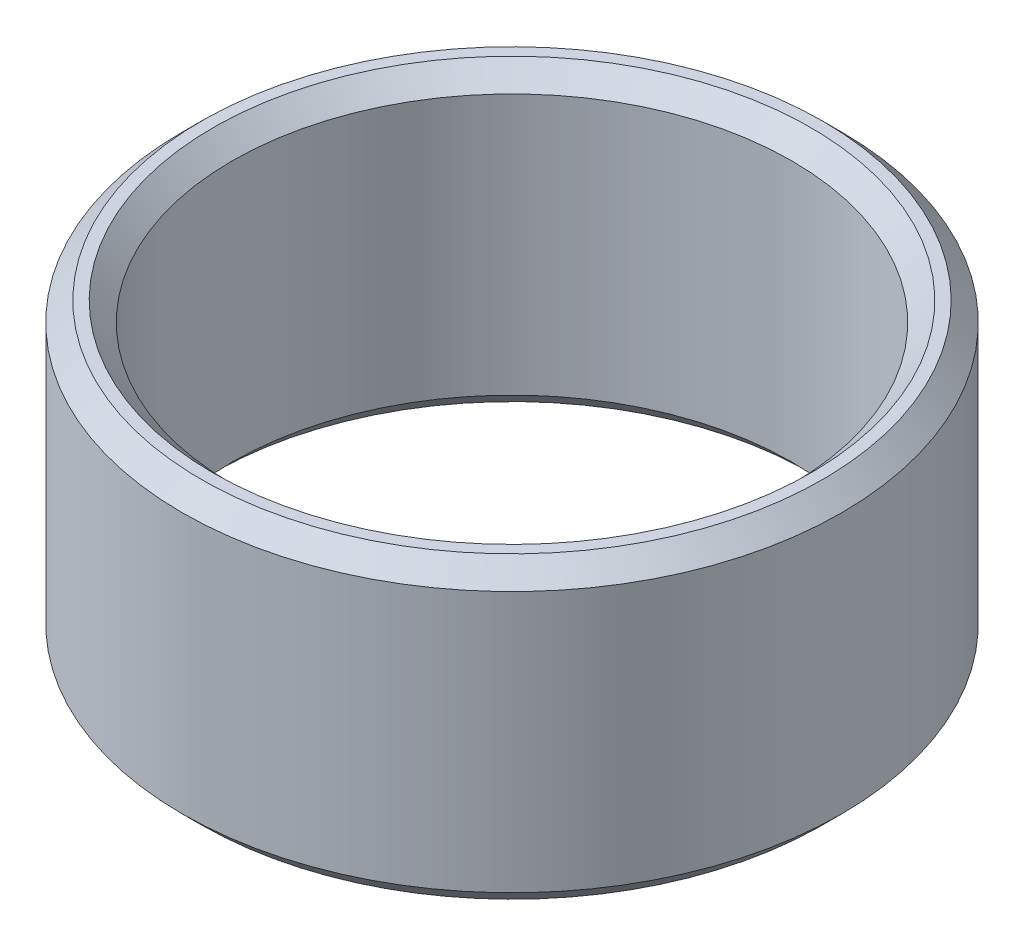
from build123d import *

# Parameters (mm, degrees)
SKETCH1_R           = 30
BOSS_EXTRUDE1_DEPTH = 27.218292106
SKETCH2_R           = 25.462317375
CUT_EXTRUDE1_DEPTH  = 51.406700201
CHAMFER1_SIZE       = 1.742513884


with BuildPart() as part:
    # Sketch1 → Boss-Extrude1 (new body)
    with BuildSketch(Plane(origin=(0, 0, 0), x_dir=(1, 0, 0), z_dir=(0, 1, 0))):
        Circle(SKETCH1_R)
    extrude(amount=BOSS_EXTRUDE1_DEPTH)

    # Sketch2 → Cut-Extrude1 (cut, through all)
    with BuildSketch(Plane(origin=(0, 0, 0), x_dir=(1, 0, 0), z_dir=(0, 1, 0))):
        Circle(SKETCH2_R)
    extrude(amount=CUT_EXTRUDE1_DEPTH, mode=Mode.SUBTRACT)

    # Chamfer1
    chamfer1_edges = [part.edges().sort_by_distance(p)[0] for p in [
        (-25.462317375, 27.218292106, 0),
        (-25.462317375, 0, 0),
        (-30, 0, 0),
        (-30, 27.218292106, 0),
    ]]
    chamfer(chamfer1_edges, length=CHAMFER1_SIZE)


solid = part.part
